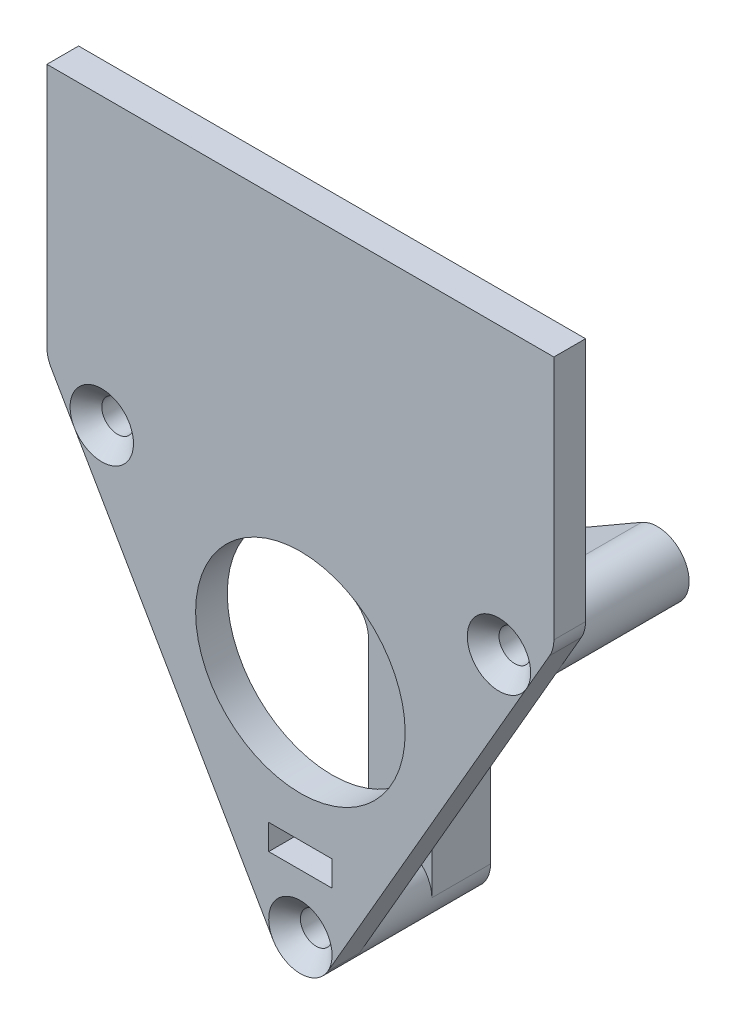
from build123d import *

# Parameters (mm, degrees)
BOSS_EXTRUDE1_DEPTH          = 3.175
SKETCH2_R                    = 21
CUT_EXTRUDE1_DEPTH           = 96.087760678
FILLET1_R                    = 6.35
SKETCH3_W                    = 12.7
SKETCH3_H                    = 5.08
CUT_EXTRUDE2_DEPTH           = 96.087760678
SKETCH5_R                    = 6.35
BOSS_EXTRUDE3_DEPTH          = 25.4
SKETCH6_R                    = 3.175
CUT_EXTRUDE3_DEPTH           = 25.4
CHAMFER2_SIZE                = 3.175
BOSS_EXTRUDE4_START          = -11.75
BOSS_EXTRUDE4_DEPTH          = 11.75
CIRPATTERN2_COUNT            = 3
CHAMFER2_OF_CIRPATTERN2_SIZE = 3.175
FILLET2_R                    = 6.35
SKETCH9_R                    = 3
CUT_EXTRUDE4_DEPTH           = 101.047100061


with BuildPart() as part:
    # Sketch1 → Boss-Extrude1 (new, symmetric)
    with BuildSketch(Plane.XY):
        Polygon((0, -58.65878735), (-50.8, 29.329393675), (-50.8, 80.129393675), (50.8, 80.129393675), (50.8, 29.329393675), align=None)
    extrude(amount=BOSS_EXTRUDE1_DEPTH, both=True)

    # Sketch2 → Cut-Extrude1 (cut, through all)
    with BuildSketch(Plane.XY.offset(3.175)):
        Circle(SKETCH2_R)
    extrude(amount=-CUT_EXTRUDE1_DEPTH, mode=Mode.SUBTRACT)

    # Fillet1
    fillet1_edges = [part.edges().sort_by_distance(p)[0] for p in [
        (0, -58.65878735, 0),
        (-50.8, 29.329393675, 0),
        (50.8, 29.329393675, 0),
    ]]
    fillet(fillet1_edges, radius=FILLET1_R)

    # Sketch3 → Cut-Extrude2 (cut, through all)
    with BuildSketch(Plane.XY.offset(3.175)):
        with Locations((0, -31.75)):
            Rectangle(SKETCH3_W, SKETCH3_H)
    extrude(amount=-CUT_EXTRUDE2_DEPTH, mode=Mode.SUBTRACT)

    # Sketch5 → Boss-Extrude3 (add)
    with BuildSketch(Plane(origin=(0, 0, -3.175), x_dir=(-1, 0, 0), z_dir=(0, 0, -1))):
        with Locations((0, -45.95878735)):
            Circle(SKETCH5_R)
    boss_extrude3 = extrude(amount=BOSS_EXTRUDE3_DEPTH)

    # Sketch6 → Cut-Extrude3 (cut)
    with BuildSketch(Plane.XY.offset(3.175)):
        with Locations((0, -45.95878735)):
            Circle(SKETCH6_R)
    cut_extrude3 = extrude(amount=-CUT_EXTRUDE3_DEPTH, mode=Mode.SUBTRACT)

    # Chamfer2
    chamfer2_edges = [part.edges().sort_by_distance(p)[0] for p in [
        (-3.175, -45.95878735, 3.175),
    ]]
    chamfer(chamfer2_edges, length=CHAMFER2_SIZE - 0.0001)  # a hair under: the kernel refuses the full size

    # Sketch8 → Boss-Extrude4 (add)
    with BuildSketch(Plane(origin=(0, 0, -28.575), x_dir=(-1, 0, 0), z_dir=(0, 0, -1)).offset(BOSS_EXTRUDE4_START)):
        with BuildLine():
            Line((-6.35, 0), (-6.35, -45.95878735))
            ThreePointArc((-6.35, -45.95878735), (0, -39.60878735), (6.35, -45.95878735))
            Line((6.35, -45.95878735), (6.35, 0))
            Line((6.35, 0), (-6.35, 0))
        make_face()
    boss_extrude4 = extrude(amount=BOSS_EXTRUDE4_DEPTH)

    # CirPattern2: Boss-Extrude3, Cut-Extrude3, Boss-Extrude4 ×3 about axis
    cirpattern2_axis = Axis((0, 0, 0), (0, 0, 1))
    add([boss_extrude3.rotate(cirpattern2_axis, i * 360 / CIRPATTERN2_COUNT) for i in range(1, CIRPATTERN2_COUNT)])
    add([cut_extrude3.rotate(cirpattern2_axis, i * 360 / CIRPATTERN2_COUNT) for i in range(1, CIRPATTERN2_COUNT)], mode=Mode.SUBTRACT)
    add([boss_extrude4.rotate(cirpattern2_axis, i * 360 / CIRPATTERN2_COUNT) for i in range(1, CIRPATTERN2_COUNT)])

    # Chamfer2 of CirPattern2
    chamfer2_of_cirpattern2_edges = [part.edges().sort_by_distance(p)[0] for p in [
        (41.388977372, 20.229763018, 3.175),
        (-38.213977372, 25.729024332, 3.175),
    ]]
    chamfer(chamfer2_of_cirpattern2_edges, length=CHAMFER2_OF_CIRPATTERN2_SIZE - 0.0001)  # a hair under: the kernel refuses the full size

    # Fillet2
    fillet2_edges = [part.edges().sort_by_distance(p)[0] for p in [
        (-6.35, -3.666174209, -22.7),
        (0, 7.332348419, -22.7),
        (6.35, -3.666174209, -22.7),
    ]]
    fillet(fillet2_edges, radius=FILLET2_R)

    # Sketch9 → Cut-Extrude4 (cut, through all)
    with BuildSketch(Plane(origin=(0, 0, -28.575), x_dir=(-1, 0, 0), z_dir=(0, 0, -1))):
        Circle(SKETCH9_R)
    extrude(amount=-CUT_EXTRUDE4_DEPTH, mode=Mode.SUBTRACT)


solid = part.part
